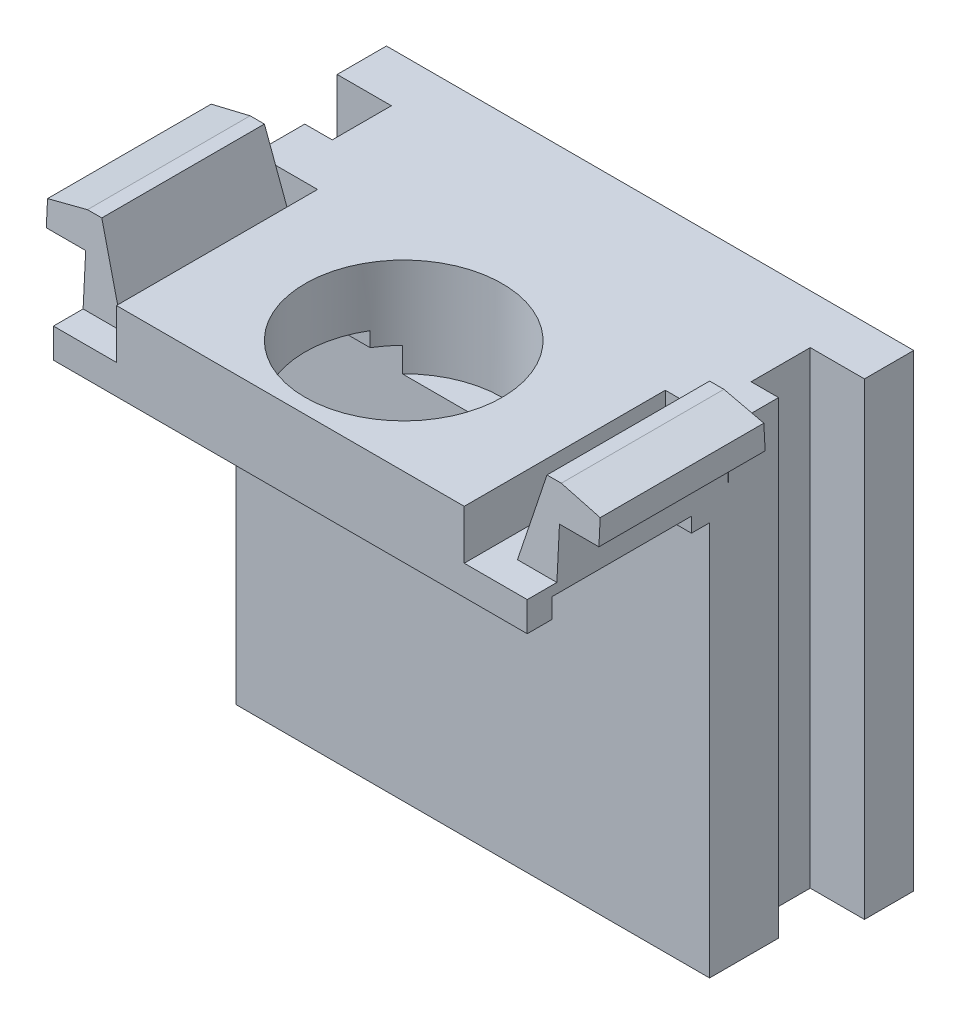
from build123d import *

# Parameters (mm, degrees)
SKETCH2_W                       = 27.178
SKETCH2_H                       = 21.59
INITIAL_EXTRUDE_DEPTH           = 6.35
SKETCH3_W                       = 27.178
SKETCH3_H                       = 1.27
INTIAL_EXTRUDE_HORIZONTAL_DEPTH = 12.192
SKETCH4_W                       = 27.178
SKETCH4_H                       = 1.27
SLIGHT_EXTRUDE_VERTICAL_DEPTH   = 0.254
SKETCH5_W                       = 3.048
SKETCH5_H                       = 21.59
CUT_EXTRUDE1_DEPTH              = 2.794
CUT_EXTRUDE2_REACH              = 33.537
SKETCH6_W                       = 1.379153921
SKETCH6_H                       = 12.954
SNAP_START                      = 11.473246079
SNAP_HOOK2_DEPTH                = 0.7366
SNAP_START_2                    = 8.31223189
SNAP_HOOK2_2_DEPTH              = 8.568362063
SNAP_START_3                    = 8.179116131
SNAP_HOOK2_3_DEPTH              = 8.834593581
SNAP_START_4                    = 9
SNAP_HOOK2_4_DEPTH              = 6
BOSS_EXTRUDE1_DEPTH             = 2.54
SKETCH8_W                       = 24.419692158
SKETCH8_H                       = 7.195933706
CUT_EXTRUDE3_DEPTH              = 0.762
SKETCH9_W                       = 24.419692158
SKETCH9_H                       = 20.32
BOSS_EXTRUDE2_DEPTH             = 2.794
SKETCH10_R                      = 5.08
CUT_EXTRUDE4_DEPTH              = 5.08


with BuildPart() as part:
    # Sketch2 → Initial Extrude (new body)
    with BuildSketch(Plane.XY):
        Rectangle(SKETCH2_W, SKETCH2_H)
    extrude(amount=INITIAL_EXTRUDE_DEPTH)

    # Sketch3 → Intial Extrude horizontal (add)
    with BuildSketch(Plane.XY.offset(6.35)):
        with Locations((0, 10.16)):
            Rectangle(SKETCH3_W, SKETCH3_H)
    extrude(amount=INTIAL_EXTRUDE_HORIZONTAL_DEPTH)

    # Sketch4 → Slight Extrude vertical (add)
    with BuildSketch(Plane.XZ.offset(-9.525)):
        with Locations((0, 17.907)):
            Rectangle(SKETCH4_W, SKETCH4_H)
    extrude(amount=SLIGHT_EXTRUDE_VERTICAL_DEPTH)

    # Sketch5 → Cut-Extrude1 (cut)
    with BuildSketch(Plane.ZY.offset(13.589)):
        with Locations((4.064, 0)):
            Rectangle(SKETCH5_W, SKETCH5_H)
    cut_extrude1 = extrude(amount=-CUT_EXTRUDE1_DEPTH, mode=Mode.SUBTRACT)

    # Mirror3: Cut-Extrude1 across plane
    add(cut_extrude1.mirror(Plane(origin=(0, 0, 0), x_dir=(0, 0, 1), z_dir=(1, 0, 0))), mode=Mode.SUBTRACT)

    # Sketch6 → Cut-Extrude2 (cut, up to next)
    with BuildSketch(Plane(origin=(0, 10.795, 0), x_dir=(1, 0, 0), z_dir=(0, 1, 0)), mode=Mode.PRIVATE) as cut_extrude2_sk1:
        with Locations((12.89942304, -12.065)):
            Rectangle(SKETCH6_W, SKETCH6_H)
    cut_extrude2_tool1 = extrude(cut_extrude2_sk1.sketch, amount=-CUT_EXTRUDE2_REACH, mode=Mode.PRIVATE) & part.part
    cut_extrude2 = cut_extrude2_tool1.solids().sort_by_distance((12.899423, 10.795, 12.065))[0]
    add(cut_extrude2, mode=Mode.SUBTRACT)

    # Mirror7: Cut-Extrude2 across plane
    add(cut_extrude2.mirror(Plane(origin=(0, 0, 0), x_dir=(0, 0, 1), z_dir=(1, 0, 0))), mode=Mode.SUBTRACT)

    # Snap Hook2: read off the stored shape, not the designer's step
    # Snap Hook2 outline → Snap Hook2 (add)
    with BuildSketch(Plane.YZ.offset(SNAP_START)):
        Polygon((10.795, 17.013709712), (10.795, 8.179116131), (15.113, 8.405412922), (15.113, 16.787412922), align=None)
    snap_hook2 = extrude(amount=SNAP_HOOK2_DEPTH)

    # Snap Hook2 2 outline → Snap Hook2 2 (add)
    with BuildSketch(Plane.XY.offset(SNAP_START_2)):
        Polygon((11.473246079, 10.795), (11.473246079, 15.113), (10.177846079, 10.795), align=None)
        Polygon((12.209846079, 15.113), (12.209846079, 13.335), (14.241846079, 13.335), (14.241846079, 14.605), align=None)
    snap_hook2_2 = extrude(amount=SNAP_HOOK2_2_DEPTH)

    # Snap Hook2 3 outline → Snap Hook2 3 (add)
    with BuildSketch(Plane.XY.offset(SNAP_START_3)):
        Polygon((11.473246079, 10.795), (11.473246079, 15.113), (10.177846079, 10.795), align=None)
    snap_hook2_3 = extrude(amount=SNAP_HOOK2_3_DEPTH)

    # Snap Hook2 4 outline → Snap Hook2 4 (cut)
    with BuildSketch(Plane.YZ.offset(SNAP_START_4)):
        Polygon((10.795, 8.179116131), (17, 8.179116131), (17, 8.504306402), (15.113, 8.405412922), align=None)
        Polygon((15.113, 16.787412922), (17, 16.688519443), (17, 17.013709712), (10.795, 17.013709712), align=None)
    snap_hook2_4 = extrude(amount=SNAP_HOOK2_4_DEPTH, mode=Mode.SUBTRACT)

    # Mirror6: Snap Hook2, Snap Hook2 2, Snap Hook2 3, Snap Hook2 4 across plane
    add(snap_hook2.mirror(Plane(origin=(0, 0, 0), x_dir=(0, 0, 1), z_dir=(1, 0, 0))))
    add(snap_hook2_2.mirror(Plane(origin=(0, 0, 0), x_dir=(0, 0, 1), z_dir=(1, 0, 0))))
    add(snap_hook2_3.mirror(Plane(origin=(0, 0, 0), x_dir=(0, 0, 1), z_dir=(1, 0, 0))))
    add(snap_hook2_4.mirror(Plane(origin=(0, 0, 0), x_dir=(0, 0, 1), z_dir=(1, 0, 0))), mode=Mode.SUBTRACT)

    # Sketch7 → Boss-Extrude1 (add)
    with BuildSketch(Plane(origin=(0, 10.795, 0), x_dir=(1, 0, 0), z_dir=(0, 1, 0))):
        Polygon((-8.962447439, -8.179116131), (-8.962447439, -18.542), (8.962447439, -18.542), (8.962447439, -8.179116131), (9, -8.179116131), (10.177846079, -8.179116131), (12.209846079, -8.179116131), (12.209846079, -5.588), (10.795, -5.588), (10.795, -2.54), (13.589, -2.54), (13.589, 0), (-13.589, 0), (-13.589, -2.54), (-10.795, -2.54), (-10.795, -5.588), (-12.209846079, -5.588), (-12.209846079, -8.179116131), (-10.177846079, -8.179116131), (-9, -8.179116131), align=None)
    extrude(amount=BOSS_EXTRUDE1_DEPTH)

    # Sketch8 → Cut-Extrude3 (cut)
    with BuildSketch(Plane.XZ.offset(-9.525)):
        with Locations((0, 13.674033147)):
            Rectangle(SKETCH8_W, SKETCH8_H)
    extrude(amount=-CUT_EXTRUDE3_DEPTH, mode=Mode.SUBTRACT)

    # Sketch9 → Boss-Extrude2 (add)
    with BuildSketch(Plane.XY.offset(6.35)):
        with Locations((0, -0.635)):
            Rectangle(SKETCH9_W, SKETCH9_H)
    extrude(amount=BOSS_EXTRUDE2_DEPTH)

    # Sketch10 → Cut-Extrude4 (cut)
    with BuildSketch(Plane(origin=(0, 13.335, 0), x_dir=(1, 0, 0), z_dir=(0, 1, 0))):
        with Locations(Location((0, -12.7, 0), (0, 0, 270))):
            Circle(SKETCH10_R)
    extrude(amount=-CUT_EXTRUDE4_DEPTH, mode=Mode.SUBTRACT)


solid = part.part
